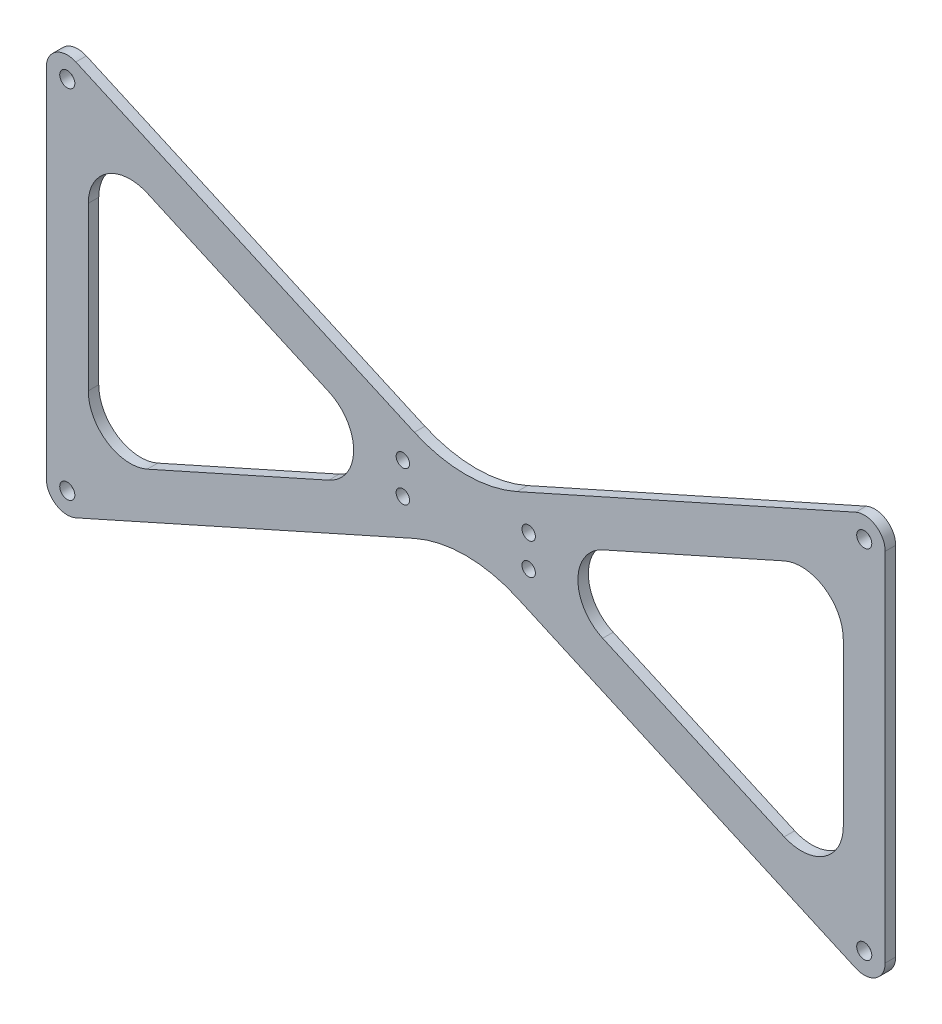
from build123d import *

# Parameters (mm, degrees)
BOSS_EXTRUDE1_DEPTH = 3.175
SKETCH2_R           = 2.286
CUT_EXTRUDE1_DEPTH  = 141.634939649
FILLET1_R           = 12.7
FILLET5_R           = 38.1
SKETCH5_R           = 2.032
CUT_EXTRUDE3_DEPTH  = 141.634939649


with BuildPart() as part:
    # Sketch1 → Boss-Extrude1 (new body)
    with BuildSketch(Plane.XY):
        with BuildLine():
            Line((-118.056875519, 59.7713959), (0, 6.956477904))
            Line((0, 6.956477904), (118.056875519, 59.7713959))
            ThreePointArc((118.056875519, 59.7713959), (124.103705224, 59.303641499), (127, 53.975))
            Line((127, 53.975), (127, -53.975))
            ThreePointArc((127, -53.975), (124.103705224, -59.303641499), (118.056875519, -59.7713959))
            Line((118.056875519, -59.7713959), (0, -6.956477904))
            Line((0, -6.956477904), (-118.056875519, -59.7713959))
            ThreePointArc((-118.056875519, -59.7713959), (-124.103705224, -59.303641499), (-127, -53.975))
            Line((-127, -53.975), (-127, 53.975))
            ThreePointArc((-127, 53.975), (-124.103705224, 59.303641499), (-118.056875519, 59.7713959))
        make_face()
        Polygon((-114.3, -44.177732622), (-15.549774139, 0), (-114.3, 44.177732622), align=None, mode=Mode.SUBTRACT)
        Polygon((15.549774139, 0), (114.3, 44.177732622), (114.3, -44.177732622), align=None, mode=Mode.SUBTRACT)
    extrude(amount=BOSS_EXTRUDE1_DEPTH)

    # Sketch2 → Cut-Extrude1 (cut, through all)
    with BuildSketch(Plane.XY.offset(3.175)):
        with Locations((-120.65, 53.975)):
            Circle(SKETCH2_R)
        with Locations((-120.65, -53.975)):
            Circle(SKETCH2_R)
        with Locations((120.65, -53.975)):
            Circle(SKETCH2_R)
        with Locations((120.65, 53.975)):
            Circle(SKETCH2_R)
    extrude(amount=-CUT_EXTRUDE1_DEPTH, mode=Mode.SUBTRACT)

    # Fillet1
    fillet1_edges = [part.edges().sort_by_distance(p)[0] for p in [
        (114.3, -44.177732622, 1.5875),
        (114.3, 44.177732622, 1.5875),
        (15.549774139, 0, 1.5875),
        (-114.3, -44.177732622, 1.5875),
        (-15.549774139, 0, 1.5875),
        (-114.3, 44.177732622, 1.5875),
    ]]
    fillet(fillet1_edges, radius=FILLET1_R)

    # Fillet5
    fillet5_edges = [part.edges().sort_by_distance(p)[0] for p in [
        (0, -6.956477904, 1.5875),
        (0, 6.956477904, 1.5875),
    ]]
    fillet(fillet5_edges, radius=FILLET5_R)

    # Sketch5 → Cut-Extrude3 (cut, through all)
    with BuildSketch(Plane.XY.offset(3.175)):
        with Locations((-19.05, 4.879946721)):
            Circle(SKETCH5_R)
        with Locations((-19.05, -4.645053279)):
            Circle(SKETCH5_R)
    cut_extrude3 = extrude(amount=-CUT_EXTRUDE3_DEPTH, mode=Mode.SUBTRACT)

    # Mirror1: Cut-Extrude3 across plane
    add(cut_extrude3.mirror(Plane(origin=(0, 0, 0), x_dir=(0, 0, 1), z_dir=(1, 0, 0))), mode=Mode.SUBTRACT)


solid = part.part
